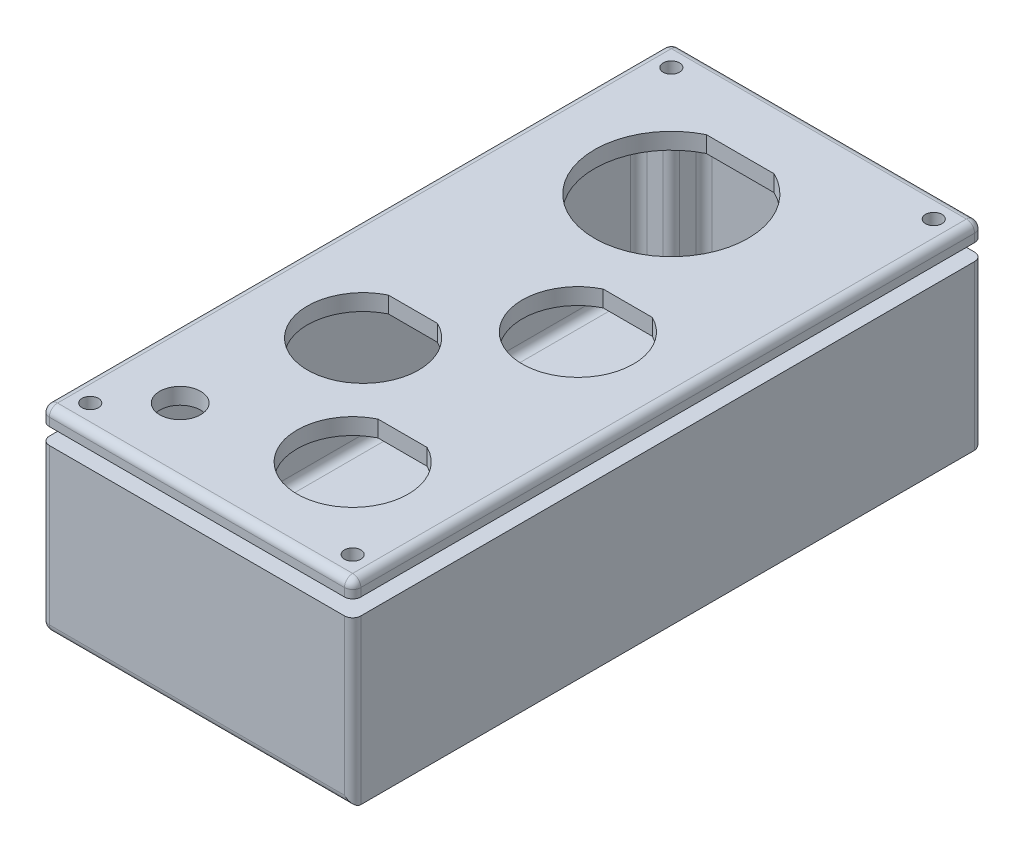
from build123d import *

# Parameters (mm, degrees)
CASE_OUTLINE_SKETCH_W    = 38.1
CASE_OUTLINE_SKETCH_H    = 77.08
BOSS_EXTRUDE1_DEPTH      = 20
CUT_EXTRUDE1_DEPTH       = 18
FILLET2_R                = 1
LID_SCREW_HOLES_SKETCH_R = 1
CUT_EXTRUDE2_DEPTH       = 10
BOSS_EXTRUDE4_START      = 2
LID_SKETCH_R             = 1
BOSS_EXTRUDE4_DEPTH      = 2
CUT_EXTRUDE3_REACH       = 50.293
LID_CUTTOUTS_SKETCH_R    = 2.5
SPLIT1_START             = 20
SPLIT1_OUTLINE_R         = 1
SPLIT1_OUTLINE_R_2       = 2.5
SPLIT1_DEPTH             = 2
SPLIT1_2_OUTLINE_R       = 1
SPLIT1_2_OUTLINE_R_2     = 2.5
SPLIT1_2_DEPTH           = 2
FILLET3_R                = 1
POWER_WIRES_ENTRY_R      = 1.5
CUT_EXTRUDE4_DEPTH       = 2


with BuildPart() as part:
    # Case Outline Sketch → Boss-Extrude1 (new body)
    with BuildSketch(Plane(origin=(0, 0, 0), x_dir=(1, 0, 0), z_dir=(0, 1, 0))):
        Rectangle(CASE_OUTLINE_SKETCH_W, CASE_OUTLINE_SKETCH_H)
    extrude(amount=BOSS_EXTRUDE1_DEPTH)

    # Sketch2 → Cut-Extrude1 (cut)
    with BuildSketch(Plane(origin=(0, 20, 0), x_dir=(1, 0, 0), z_dir=(0, 1, 0))):
        Polygon((-13.05, 36.54), (13.05, 36.54), (13.05, 32.54), (17.05, 32.54), (17.05, -32.54), (13.05, -32.54), (13.05, -36.54), (-13.05, -36.54), (-13.05, -32.54), (-17.05, -32.54), (-17.05, 32.54), (-13.05, 32.54), align=None)
    extrude(amount=-CUT_EXTRUDE1_DEPTH, mode=Mode.SUBTRACT)

    # Fillet2
    fillet2_edges = [part.edges().sort_by_distance(p)[0] for p in [
        (13.05, 11, -36.54),
        (13.05, 11, -32.54),
        (17.05, 11, -32.54),
        (17.05, 11, 32.54),
        (13.05, 11, 32.54),
        (13.05, 11, 36.54),
        (-13.05, 11, 36.54),
        (-13.05, 11, 32.54),
        (-17.05, 11, 32.54),
        (-17.05, 11, -32.54),
        (-13.05, 11, -32.54),
        (-13.05, 11, -36.54),
        (13.05, 2, -34.54),
        (15.05, 2, -32.54),
        (17.05, 2, 0),
        (15.05, 2, 32.54),
        (13.05, 2, 34.54),
        (-13.05, 2, 34.54),
        (-15.05, 2, 32.54),
        (-17.05, 2, 0),
        (-15.05, 2, -32.54),
        (-13.05, 2, -34.54),
        (0, 2, -36.54),
        (0, 0, 38.54),
        (-19.05, 0, 0),
        (0, 0, -38.54),
        (19.05, 10, 38.54),
        (-19.05, 10, 38.54),
        (-19.05, 10, -38.54),
        (19.05, 10, -38.54),
    ]]
    fillet(fillet2_edges, radius=FILLET2_R)

    # Lid Screw Holes Sketch → Cut-Extrude2 (cut)
    with BuildSketch(Plane(origin=(0, 20, 0), x_dir=(1, 0, 0), z_dir=(0, 1, 0))):
        with Locations(Location((-16.05, 35.54, 0), (0, 0, 270))):
            Circle(LID_SCREW_HOLES_SKETCH_R)
        with Locations(Location((16.05, 35.54, 0), (0, 0, 270))):
            Circle(LID_SCREW_HOLES_SKETCH_R)
        with Locations(Location((16.05, -35.54, 0), (0, 0, 270))):
            Circle(LID_SCREW_HOLES_SKETCH_R)
        with Locations(Location((-16.05, -35.54, 0), (0, 0, 270))):
            Circle(LID_SCREW_HOLES_SKETCH_R)
    extrude(amount=-CUT_EXTRUDE2_DEPTH, mode=Mode.SUBTRACT)

    # Lid Sketch → Boss-Extrude4 (add)
    with BuildSketch(Plane(origin=(0, 20, 0), x_dir=(1, 0, 0), z_dir=(0, 1, 0)).offset(BOSS_EXTRUDE4_START)):
        with BuildLine():
            Line((-19.05, 37.54), (-19.05, -37.54))
            ThreePointArc((-19.05, -37.54), (-18.757106781, -38.247106781), (-18.05, -38.54))
            Line((-18.05, -38.54), (18.05, -38.54))
            ThreePointArc((18.05, -38.54), (18.757106781, -38.247106781), (19.05, -37.54))
            Line((19.05, -37.54), (19.05, 37.54))
            ThreePointArc((19.05, 37.54), (18.757106781, 38.247106781), (18.05, 38.54))
            Line((18.05, 38.54), (-18.05, 38.54))
            ThreePointArc((-18.05, 38.54), (-18.757106781, 38.247106781), (-19.05, 37.54))
        make_face()
        with Locations(Location((-16.05, 35.54, 0), (0, 0, 270))):
            Circle(LID_SKETCH_R, mode=Mode.SUBTRACT)
        with Locations(Location((-16.05, -35.54, 0), (0, 0, 270))):
            Circle(LID_SKETCH_R, mode=Mode.SUBTRACT)
        with Locations(Location((16.05, -35.54, 0), (0, 0, 270))):
            Circle(LID_SKETCH_R, mode=Mode.SUBTRACT)
        with Locations(Location((16.05, 35.54, 0), (0, 0, 270))):
            Circle(LID_SKETCH_R, mode=Mode.SUBTRACT)
    extrude(amount=-BOSS_EXTRUDE4_DEPTH)

    # Lid Cuttouts Sketch → Cut-Extrude3 (cut, up to next)
    with BuildSketch(Plane(origin=(0, 22, 0), x_dir=(1, 0, 0), z_dir=(0, 1, 0)), mode=Mode.PRIVATE) as cut_extrude3_sk1:
        with Locations(Location((-10.55, -30.04, 0), (0, 0, 270))):
            Circle(LID_CUTTOUTS_SKETCH_R)
    cut_extrude3_tool1 = extrude(cut_extrude3_sk1.sketch, amount=-CUT_EXTRUDE3_REACH, mode=Mode.PRIVATE) & part.part
    # Lid Cuttouts Sketch → Cut-Extrude3 (cut, up to next)
    with BuildSketch(Plane(origin=(0, 22, 0), x_dir=(1, 0, 0), z_dir=(0, 1, 0)), mode=Mode.PRIVATE) as cut_extrude3_sk2:
        with BuildLine():
            Line((-6.800528433, 30.5748), (1.496528433, 30.5748))
            ThreePointArc((1.496528433, 30.5748), (-2.652, 12.744), (-6.800528433, 30.5748))
        make_face()
    cut_extrude3_tool2 = extrude(cut_extrude3_sk2.sketch, amount=-CUT_EXTRUDE3_REACH, mode=Mode.PRIVATE) & part.part
    # Lid Cuttouts Sketch → Cut-Extrude3 (cut, up to next)
    with BuildSketch(Plane(origin=(0, 22, 0), x_dir=(1, 0, 0), z_dir=(0, 1, 0)), mode=Mode.PRIVATE) as cut_extrude3_sk3:
        with BuildLine():
            Line((9.25499584, 7.907162897), (3.24500416, 7.907162897))
            ThreePointArc((3.24500416, 7.907162897), (6.25, -4.992837103), (9.25499584, 7.907162897))
        make_face()
    cut_extrude3_tool3 = extrude(cut_extrude3_sk3.sketch, amount=-CUT_EXTRUDE3_REACH, mode=Mode.PRIVATE) & part.part
    # Lid Cuttouts Sketch → Cut-Extrude3 (cut, up to next)
    with BuildSketch(Plane(origin=(0, 22, 0), x_dir=(1, 0, 0), z_dir=(0, 1, 0)), mode=Mode.PRIVATE) as cut_extrude3_sk4:
        with BuildLine():
            Line((-3.24500416, -5.866362432), (-9.25499584, -5.866362432))
            ThreePointArc((-9.25499584, -5.866362432), (-6.25, -18.766362432), (-3.24500416, -5.866362432))
        make_face()
    cut_extrude3_tool4 = extrude(cut_extrude3_sk4.sketch, amount=-CUT_EXTRUDE3_REACH, mode=Mode.PRIVATE) & part.part
    # Lid Cuttouts Sketch → Cut-Extrude3 (cut, up to next)
    with BuildSketch(Plane(origin=(0, 22, 0), x_dir=(1, 0, 0), z_dir=(0, 1, 0)), mode=Mode.PRIVATE) as cut_extrude3_sk5:
        with BuildLine():
            Line((9.25499584, -19.639887762), (3.24500416, -19.639887762))
            ThreePointArc((3.24500416, -19.639887762), (6.25, -32.539887762), (9.25499584, -19.639887762))
        make_face()
    cut_extrude3_tool5 = extrude(cut_extrude3_sk5.sketch, amount=-CUT_EXTRUDE3_REACH, mode=Mode.PRIVATE) & part.part
    add(cut_extrude3_tool1.solids().sort_by_distance((-10.55, 22, 30.04))[0], mode=Mode.SUBTRACT)
    add(cut_extrude3_tool2.solids().sort_by_distance((-2.652, 22, -21.967056))[0], mode=Mode.SUBTRACT)
    add(cut_extrude3_tool3.solids().sort_by_distance((6.25, 22, -1.680155))[0], mode=Mode.SUBTRACT)
    add(cut_extrude3_tool4.solids().sort_by_distance((-6.25, 22, 12.093371))[0], mode=Mode.SUBTRACT)
    add(cut_extrude3_tool5.solids().sort_by_distance((6.25, 22, 25.866896))[0], mode=Mode.SUBTRACT)

    # Split1 2 outline → Split1 2 (cut)
    with BuildSketch(Plane(origin=(0, 0, 0), x_dir=(1, 0, 0), z_dir=(0, 1, 0)).offset(SPLIT1_START)):
        with BuildLine():
            ThreePointArc((-18.05, 38.54), (-18.757106781, 38.247106781), (-19.05, 37.54))
            Line((-19.05, 37.54), (-19.05, -37.54))
            ThreePointArc((-19.05, -37.54), (-18.757106781, -38.247106781), (-18.05, -38.54))
            Line((-18.05, -38.54), (18.05, -38.54))
            ThreePointArc((18.05, -38.54), (18.757106781, -38.247106781), (19.05, -37.54))
            Line((19.05, -37.54), (19.05, 37.54))
            ThreePointArc((19.05, 37.54), (18.757106781, 38.247106781), (18.05, 38.54))
            Line((18.05, 38.54), (-18.05, 38.54))
        make_face()
        with Locations((-16.05, -35.54)):
            Circle(SPLIT1_2_OUTLINE_R, mode=Mode.SUBTRACT)
        with Locations((-10.55, -30.04)):
            Circle(SPLIT1_2_OUTLINE_R_2, mode=Mode.SUBTRACT)
        with BuildLine():
            ThreePointArc((-3.24500416, -5.866362432), (-6.25, -18.766362432), (-9.25499584, -5.866362432))
            Line((-9.25499584, -5.866362432), (-3.24500416, -5.866362432))
        make_face(mode=Mode.SUBTRACT)
        with BuildLine():
            ThreePointArc((9.25499584, -19.639887762), (6.25, -32.539887762), (3.24500416, -19.639887762))
            Line((3.24500416, -19.639887762), (9.25499584, -19.639887762))
        make_face(mode=Mode.SUBTRACT)
        with Locations((16.05, -35.54)):
            Circle(SPLIT1_2_OUTLINE_R, mode=Mode.SUBTRACT)
        with Locations((-16.05, 35.54)):
            Circle(SPLIT1_2_OUTLINE_R, mode=Mode.SUBTRACT)
        with BuildLine():
            ThreePointArc((1.496528433, 30.5748), (-2.652, 12.744), (-6.800528433, 30.5748))
            Line((-6.800528433, 30.5748), (1.496528433, 30.5748))
        make_face(mode=Mode.SUBTRACT)
        with BuildLine():
            ThreePointArc((9.25499584, 7.907162897), (6.25, -4.992837103), (3.24500416, 7.907162897))
            Line((3.24500416, 7.907162897), (9.25499584, 7.907162897))
        make_face(mode=Mode.SUBTRACT)
        with Locations((16.05, 35.54)):
            Circle(SPLIT1_2_OUTLINE_R, mode=Mode.SUBTRACT)
    extrude(amount=SPLIT1_2_DEPTH, mode=Mode.SUBTRACT)

    # Power Wires Entry → Cut-Extrude4 (cut)
    with BuildSketch(Plane.XZ):
        with Locations(Location((0, 26.54, 0), (0, 0, 270))):
            Circle(POWER_WIRES_ENTRY_R)
    extrude(amount=-CUT_EXTRUDE4_DEPTH, mode=Mode.SUBTRACT)


with BuildPart() as body_2:
    # Split1: read off the stored shape, not the designer's step
    # Split1 outline → Split1 (new body)
    with BuildSketch(Plane(origin=(0, 0, 0), x_dir=(1, 0, 0), z_dir=(0, 1, 0)).offset(SPLIT1_START)):
        with BuildLine():
            Line((18.05, 38.54), (-18.05, 38.54))
            ThreePointArc((-18.05, 38.54), (-18.757106781, 38.247106781), (-19.05, 37.54))
            Line((-19.05, 37.54), (-19.05, -37.54))
            ThreePointArc((-19.05, -37.54), (-18.757106781, -38.247106781), (-18.05, -38.54))
            Line((-18.05, -38.54), (18.05, -38.54))
            ThreePointArc((18.05, -38.54), (18.757106781, -38.247106781), (19.05, -37.54))
            Line((19.05, -37.54), (19.05, 37.54))
            ThreePointArc((19.05, 37.54), (18.757106781, 38.247106781), (18.05, 38.54))
        make_face()
        with Locations((-16.05, -35.54)):
            Circle(SPLIT1_OUTLINE_R, mode=Mode.SUBTRACT)
        with Locations((-10.55, -30.04)):
            Circle(SPLIT1_OUTLINE_R_2, mode=Mode.SUBTRACT)
        with BuildLine():
            Line((-9.25499584, -5.866362432), (-3.24500416, -5.866362432))
            ThreePointArc((-3.24500416, -5.866362432), (-6.25, -18.766362432), (-9.25499584, -5.866362432))
        make_face(mode=Mode.SUBTRACT)
        with BuildLine():
            Line((3.24500416, -19.639887762), (9.25499584, -19.639887762))
            ThreePointArc((9.25499584, -19.639887762), (6.25, -32.539887762), (3.24500416, -19.639887762))
        make_face(mode=Mode.SUBTRACT)
        with Locations((16.05, -35.54)):
            Circle(SPLIT1_OUTLINE_R, mode=Mode.SUBTRACT)
        with Locations((-16.05, 35.54)):
            Circle(SPLIT1_OUTLINE_R, mode=Mode.SUBTRACT)
        with BuildLine():
            Line((-6.800528433, 30.5748), (1.496528433, 30.5748))
            ThreePointArc((1.496528433, 30.5748), (-2.652, 12.744), (-6.800528433, 30.5748))
        make_face(mode=Mode.SUBTRACT)
        with BuildLine():
            Line((3.24500416, 7.907162897), (9.25499584, 7.907162897))
            ThreePointArc((9.25499584, 7.907162897), (6.25, -4.992837103), (3.24500416, 7.907162897))
        make_face(mode=Mode.SUBTRACT)
        with Locations((16.05, 35.54)):
            Circle(SPLIT1_OUTLINE_R, mode=Mode.SUBTRACT)
    extrude(amount=SPLIT1_DEPTH)

    # Fillet3
    fillet3_edges = [body_2.edges().sort_by_distance(p)[0] for p in [
        (-18.757106781, 22, -38.247106781),
        (-19.05, 22, 0),
        (-18.757106781, 22, 38.247106781),
        (0, 22, 38.54),
        (18.757106781, 22, 38.247106781),
        (19.05, 22, 0),
        (18.757106781, 22, -38.247106781),
        (0, 22, -38.54),
    ]]
    fillet(fillet3_edges, radius=FILLET3_R)


with BuildPart() as body_2_1:
    # Body-Move/Copy2: read off the stored shape, not the designer's step
    # Body-Move/Copy2: moved
    add(body_2.part.moved(Location((0, 2, 0))))


solid = Compound([part.part, body_2_1.part])
